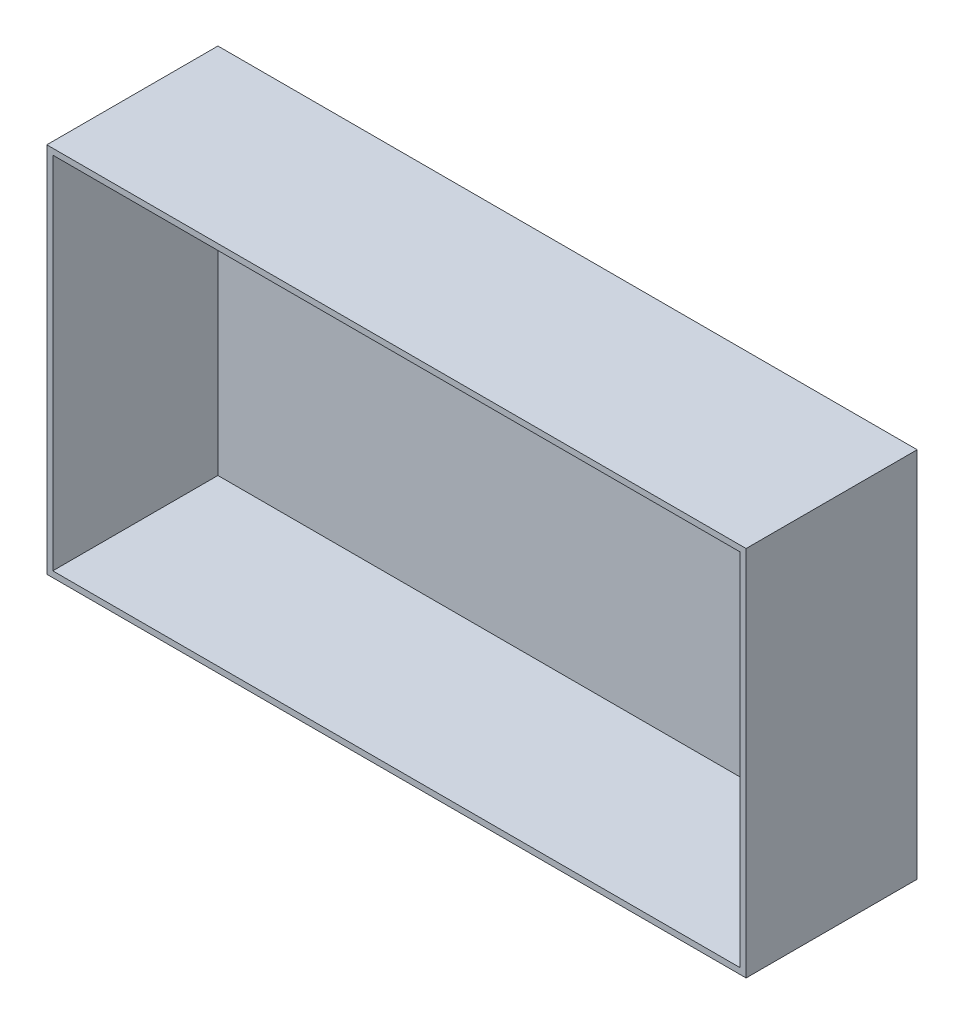
from build123d import *

# Parameters (mm, degrees)
ESQUISSE1_W        = 94
ESQUISSE1_H        = 50
BOSS_EXTRU_1_DEPTH = 23
COQUE1_T           = -0.8


with BuildPart() as part:
    # Esquisse1 → Boss.-Extru.1 (new body)
    with BuildSketch(Plane.XY):
        Rectangle(ESQUISSE1_W, ESQUISSE1_H)
    extrude(amount=BOSS_EXTRU_1_DEPTH)

    # Coque1
    coque1_openings = [part.faces().sort_by_distance(p)[0] for p in [
        (0, 0, 23),
    ]]
    offset(amount=COQUE1_T, openings=coque1_openings, kind=Kind.INTERSECTION)


solid = part.part
